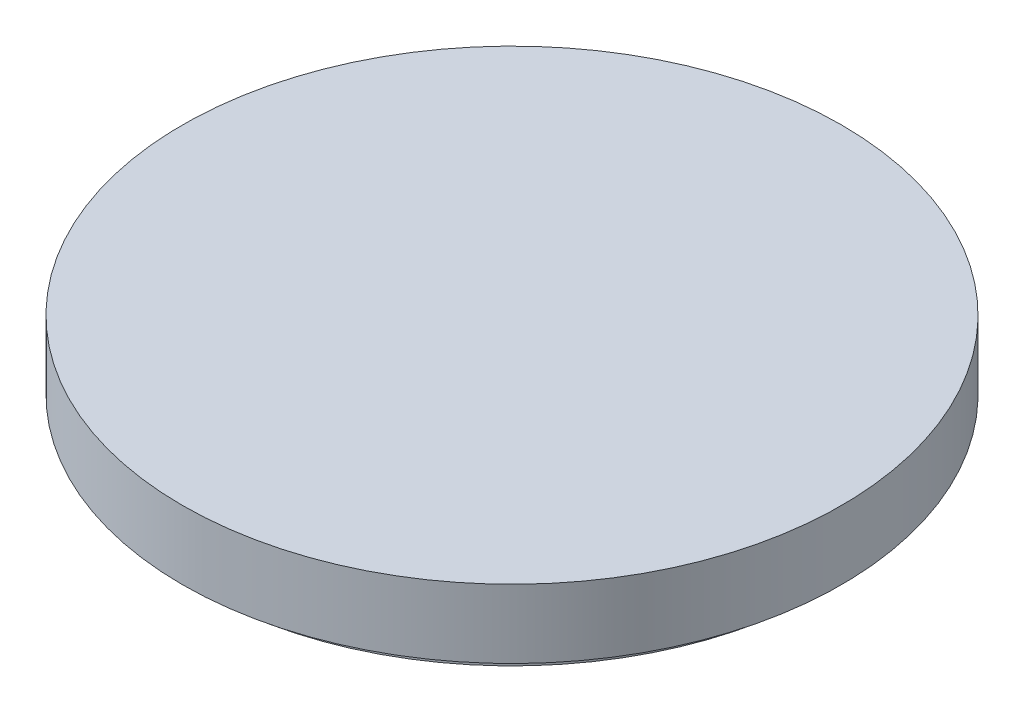
from build123d import *

# Parameters (mm, degrees)
SKETCH1_R           = 57
EXTRUDE4_DEPTH      = 7.5
EXTRUDE5_DEPTH      = 7.5
EXTRUDE5_DEPTH_BACK = 5
SKETCH_R            = 60
SKETCH_R_2          = 57


with BuildPart() as part:
    # Sketch1 → Extrude4 (new, symmetric)
    with BuildSketch(Plane(origin=(0, 0, 0), x_dir=(1, 0, 0), z_dir=(0, 1, 0))):
        Circle(SKETCH1_R)
    extrude(amount=EXTRUDE4_DEPTH, both=True)

    # Sketch → Extrude5 (add, two sides: drawn at the far end of the back side and taken through both)
    with BuildSketch(Plane(origin=(0, 0, 0), x_dir=(1, 0, 0), z_dir=(0, 1, 0)).offset(-EXTRUDE5_DEPTH_BACK)):
        Circle(SKETCH_R)
        Circle(SKETCH_R_2, mode=Mode.SUBTRACT)
    extrude(amount=EXTRUDE5_DEPTH + EXTRUDE5_DEPTH_BACK)


solid = part.part
